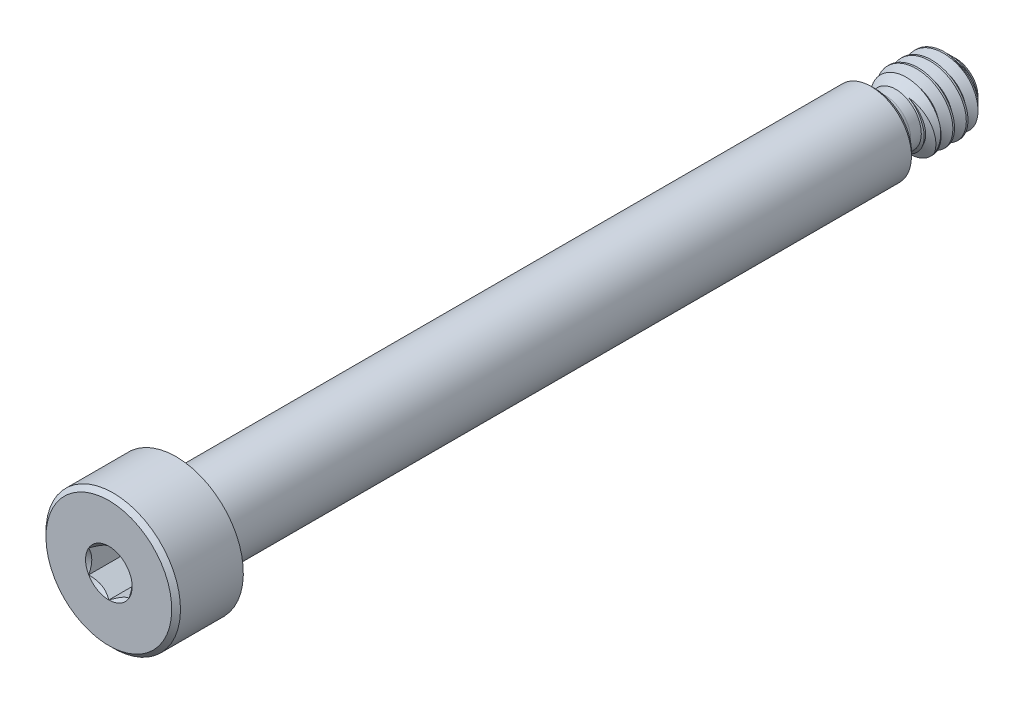
from build123d import *

# Parameters (mm, degrees)
CHAMFER1_SIZE      = 0.79375
CHAMFER2_SIZE      = 0.25796875
CUT_EXTRUDE2_DEPTH = 1.984375
CUT_SWEEP1_PITCH   = 0.79375


with BuildPart() as part:
    # Sketch1 → Revolve1 (revolve)
    with BuildSketch(Plane(origin=(0, 0, 0), x_dir=(0, 0, -1), z_dir=(1, 0, 0))):
        Polygon((-45.24375, 3.96875), (-41.275, 3.96875), (-41.275, 2.38125), (0, 2.38125), (0, 2.0828), (4.7625, 2.0828), (4.7625, 0), (-45.24375, 0), align=None)
    revolve(axis=Axis((0, 0, -4.7625), (0, 0, 1)))

    # Sketch5 → Cut-Revolve1 (revolve, cut)
    with BuildSketch(Plane(origin=(0, 0, 0), x_dir=(0, 0, -1), z_dir=(1, 0, 0))):
        with BuildLine():
            Line((0, 2.38125), (2.06375, 2.38125))
            Line((2.06375, 2.38125), (1.1938, 1.5113))
            Line((1.1938, 1.5113), (0.5715, 1.5113))
            ThreePointArc((0.5715, 1.5113), (0.167388475, 1.678688475), (0, 2.0828))
            Line((0, 2.0828), (0, 2.38125))
        make_face()
    revolve(axis=Axis((0, 0, -4.7625), (0, 0, 1)), mode=Mode.SUBTRACT)

    # Chamfer1
    chamfer1_edges = [part.edges().sort_by_distance(p)[0] for p in [
        (0, -2.0828, -4.7625),
    ]]
    chamfer(chamfer1_edges, length=CHAMFER1_SIZE)

    # Chamfer2
    chamfer2_edges = [part.edges().sort_by_distance(p)[0] for p in [
        (0, -2.38125, 0),
        (0, -3.96875, 45.24375),
    ]]
    chamfer(chamfer2_edges, length=CHAMFER2_SIZE)

    # Sketch8 → Cut-Extrude2 (cut)
    with BuildSketch(Plane.XY.offset(45.24375)):
        Polygon((1.190625, 0.687407664), (0, 1.374815329), (-1.190625, 0.687407664), (-1.190625, -0.687407664), (0, -1.374815329), (1.190625, -0.687407664), align=None)
    extrude(amount=-CUT_EXTRUDE2_DEPTH, mode=Mode.SUBTRACT)

    # Cut-Extrude4 cone 1 section (through the dimple's axis) → Cut-Extrude4 (revolve, cut)
    with BuildSketch(Plane(origin=(0, 0, 45.24375), x_dir=(0, -1, 0), z_dir=(1, 0, 0))):
        Polygon((0, 0), (1.374815329, 0), (0, 1.374815329), align=None)
    revolve(axis=Axis((0, 0, 45.24375), (0, 0, -1)), mode=Mode.SUBTRACT)


with BuildPart() as body_2:
    # Split1: the piece on the far side of the plane
    add(part.part)
    split(bisect_by=Plane.XY.offset(-1.1938), keep=Keep.BOTTOM)

    # Cut-Sweep1: the profile of Sketch4 screwed along a right-hand helix of 7 turns, 8 arcs to a turn; built about Z, then put on its axis
    cut_sweep1_z = Axis((0, 0, 0), (0, 0, 1))
    cut_sweep1_corners = [(2.125762979, 0, 0.024804688), (2.125762979, 0, -0.719335937), (1.567244252, 0, -0.396875), (1.567244252, 0, -0.29765625)]
    with BuildLine(mode=Mode.PRIVATE) as cut_sweep1_profile:
        Line(cut_sweep1_corners[0], cut_sweep1_corners[1])
        Line(cut_sweep1_corners[1], cut_sweep1_corners[2])
        Line(cut_sweep1_corners[2], cut_sweep1_corners[3])
        Line(cut_sweep1_corners[3], cut_sweep1_corners[0])
    cut_sweep1_cap = Face(cut_sweep1_profile.wire())
    cut_sweep1_turn_angles = [0, 22.5, 45, 67.5, 90, 112.5, 135, 157.5, 180, 202.5, 225, 247.5, 270, 292.5, 315, 337.5, 360]
    cut_sweep1_turn_weights = [1, 0.9238795325112867, 1, 0.9238795325112867, 1, 0.9238795325112867, 1, 0.9238795325112867, 1, 0.9238795325112867, 1, 0.9238795325112867, 1, 0.9238795325112867, 1, 0.9238795325112867, 1]
    cut_sweep1_turn_rails = [Edge.make_bspline([Vector(p[0], p[1], 0).rotate(cut_sweep1_z, cut_sweep1_turn_angles[k]) / cut_sweep1_turn_weights[k] + Vector(0, 0, p[2] + CUT_SWEEP1_PITCH * cut_sweep1_turn_angles[k] / 360) for k in range(17)], [0, 0, 0, 1, 1, 2, 2, 3, 3, 4, 4, 5, 5, 6, 6, 7, 7, 8, 8, 8], 2, cut_sweep1_turn_weights) for p in cut_sweep1_corners]
    cut_sweep1_turn_sides = [Face.make_surface_from_curves(cut_sweep1_turn_rails[p[0]], cut_sweep1_turn_rails[p[1]]) for p in [(0, 1), (1, 2), (2, 3), (3, 0)]]
    cut_sweep1 = Plane(origin=(0, 0, -4.7625), x_dir=(0, 1, 0), z_dir=(0, 0, 1)) * Solid(Shell([*[p.moved(Location((0, 0, CUT_SWEEP1_PITCH * i))) for i in range(7) for p in cut_sweep1_turn_sides], cut_sweep1_cap, cut_sweep1_cap.rotate(cut_sweep1_z, 2520).moved(Location((0, 0, CUT_SWEEP1_PITCH * 2520 / 360)))]))
    add(cut_sweep1, mode=Mode.SUBTRACT)


with BuildPart() as part_1:
    add(part.part)

    # Split1
    split(bisect_by=Plane.XY.offset(-1.1938), keep=Keep.TOP)

    # Combine1: union body 2
    add(body_2.part)


solid = part_1.part
